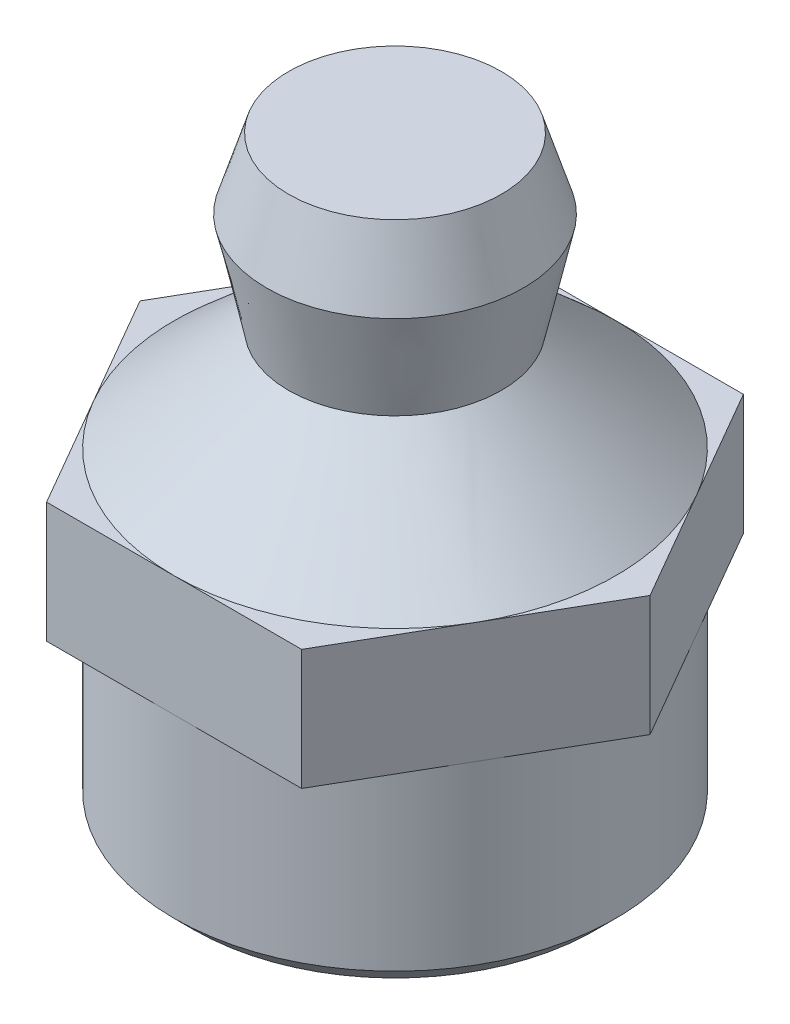
from build123d import *

# Parameters (mm, degrees)
SKETCH1_R           = 5.5
BOSS_EXTRUDE1_DEPTH = 4.89
CHAMFER1_SIZE       = 0.5
SKETCH2_R           = 2.22
BOSS_EXTRUDE2_DEPTH = 0.5
BOSS_EXTRUDE3_DEPTH = 3
SKETCH4_R           = 2.65
BOSS_EXTRUDE4_DEPTH = 2.57
SKETCH8_R           = 3.195
SKETCH5_R           = 2.65


with BuildPart() as part:
    # Sketch1 → Boss-Extrude1 (new body)
    with BuildSketch(Plane(origin=(0, 0, 0), x_dir=(1, 0, 0), z_dir=(0, 1, 0))):
        with Locations(Location((0, 0, 0), (0, 0, 270))):
            Circle(SKETCH1_R)
    extrude(amount=BOSS_EXTRUDE1_DEPTH)

    # Chamfer1
    chamfer1_edges = [part.edges().sort_by_distance(p)[0] for p in [
        (0, 0, -5.5),
    ]]
    chamfer(chamfer1_edges, length=CHAMFER1_SIZE)

    # Sketch2 → Boss-Extrude2 (add)
    with BuildSketch(Plane(origin=(0, 0, 0), x_dir=(-1, 0, 0), z_dir=(0, -1, 0))):
        with Locations(Location((0, 0, 0), (0, 0, 90))):
            Circle(SKETCH2_R)
    extrude(amount=BOSS_EXTRUDE2_DEPTH)

    # Sketch3 → Boss-Extrude3 (add)
    with BuildSketch(Plane(origin=(0, 4.89, 0), x_dir=(1, 0, 0), z_dir=(0, 1, 0))):
        Polygon((-6.350852961, 0), (-3.175426481, -5.5), (3.175426481, -5.5), (6.350852961, 0), (3.175426481, 5.5), (-3.175426481, 5.5), align=None)
    extrude(amount=BOSS_EXTRUDE3_DEPTH)

    # Sketch4 → Boss-Extrude4 (add)
    with BuildSketch(Plane(origin=(0, 7.89, 0), x_dir=(1, 0, 0), z_dir=(0, 1, 0))):
        with Locations(Location((0, 0, 0), (0, 0, 270))):
            Circle(SKETCH4_R)
    extrude(amount=BOSS_EXTRUDE4_DEPTH)

    # Loft1: read off the stored shape, not the designer's step
    # Loft1: loft between two sections, ruled curve by curve
    loft1_from = [
        Edge.make_bspline([(2.920740302, 7.89, 4.660394413), (12.241529129, 7.89, -1.181086191), (6.400048524, 7.89, -10.501875018), (-2.920740302, 7.89, -4.660394413), (-12.241529129, 7.89, 1.181086191), (-6.400048524, 7.89, 10.501875018), (2.920740302, 7.89, 4.660394413)], [0, 0, 0, 0, 0.5, 0.5, 0.5, 1, 1, 1, 1], 3, [1, 0.333333333, 0.333333333, 1, 0.333333333, 0.333333333, 1]),
    ]
    loft1_to = [
        Edge.make_bspline([(1.954409761, 10.46, 1.789631942), (5.533673644, 10.46, -2.11918758), (1.624854122, 10.46, -5.698451464), (-1.954409761, 10.46, -1.789631942), (-5.533673644, 10.46, 2.11918758), (-1.624854122, 10.46, 5.698451464), (1.954409761, 10.46, 1.789631942)], [0, 0, 0, 0, 0.5, 0.5, 0.5, 1, 1, 1, 1], 3, [1, 0.333333333, 0.333333333, 1, 0.333333333, 0.333333333, 1]),
    ]
    loft1 = Solid(Shell([*[Face.make_surface_from_curves(loft1_from[k], loft1_to[k]) for k in range(1)], Face(Wire(loft1_from)), Face(Wire(loft1_to))]))
    add(loft1)

    # Sketch8 → section 1 of loft2
    with BuildSketch(Plane(origin=(0, 12.94, 0), x_dir=(1, 0, 0), z_dir=(0, 1, 0)), mode=Mode.PRIVATE) as loft2_s1:
        Circle(SKETCH8_R)
    # loft up to a face of the part (loft2)
    loft([Face(Wire([part.edges().sort_by_distance((-0.033300005, 10.46, -2.649790767))[0]])), loft2_s1.sketch])

    # Sketch5 → section 1 of loft3
    with BuildSketch(Plane(origin=(0, 14.69, 0), x_dir=(1, 0, 0), z_dir=(0, 1, 0)), mode=Mode.PRIVATE) as loft3_s1:
        Circle(SKETCH5_R)
    # loft up to a face of the part (loft3)
    loft([Face(Wire([part.edges().sort_by_distance((-0.040148497, 12.94, -3.194747736))[0]])), loft3_s1.sketch])


solid = part.part
